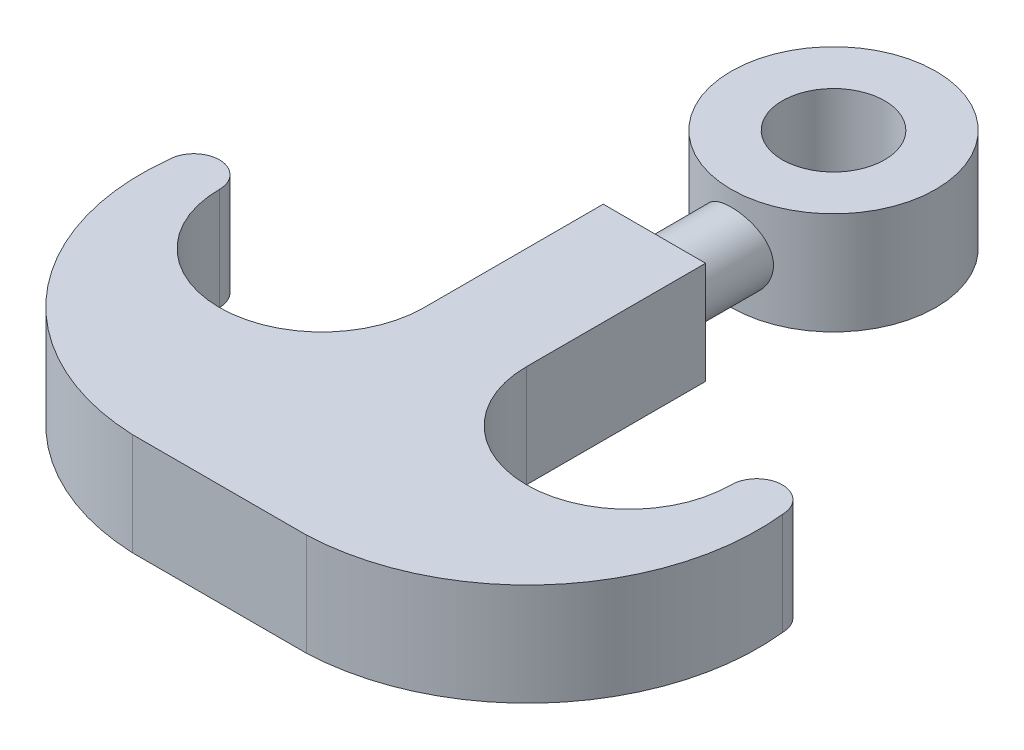
from build123d import *

# Parameters (mm, degrees)
BOSS_EXTRUDE1_DEPTH        = 10
BOSS_EXTRUDE1_DEPTH_BACK   = 10
SKETCH4_R                  = 20
SKETCH4_R_2                = 10
BOSS_EXTRUDE1_2_DEPTH      = 10
BOSS_EXTRUDE1_2_DEPTH_BACK = 10
SKETCH6_R                  = 7
BOSS_EXTRUDE2_DEPTH        = 20
FILLET1_R                  = 3


with BuildPart() as part:
    # Sketch4 → Boss-Extrude1 (new, two sides: drawn at the far end of the back side and taken through both)
    with BuildSketch(Plane(origin=(0, 0, 0), x_dir=(1, 0, 0), z_dir=(0, 1, 0)).offset(-BOSS_EXTRUDE1_DEPTH_BACK)):
        with Locations(Location((0, 0, 0), (0, 0, 270))):
            Circle(SKETCH4_R)
        with Locations(Location((0, 0, 0), (0, 0, 270))):
            Circle(SKETCH4_R_2, mode=Mode.SUBTRACT)
    extrude(amount=BOSS_EXTRUDE1_DEPTH + BOSS_EXTRUDE1_DEPTH_BACK)



with BuildPart() as body_2:
    # Sketch4 → Boss-Extrude1 2 (new, two sides: drawn at the far end of the back side and taken through both)
    with BuildSketch(Plane(origin=(0, 0, 0), x_dir=(1, 0, 0), z_dir=(0, 1, 0)).offset(-BOSS_EXTRUDE1_2_DEPTH_BACK)):
        with BuildLine():
            Line((-10, -35), (10, -35))
            Line((10, -35), (10, -70))
            ThreePointArc((10, -70), (30, -90), (50, -70))
            ThreePointArc((50, -70), (55, -65), (60, -70))
            ThreePointArc((60, -70), (49.38848107, -104.36409372), (17, -120))
            Line((17, -120), (-17, -120))
            ThreePointArc((-17, -120), (-49.38848107, -104.36409372), (-60, -70))
            ThreePointArc((-60, -70), (-55, -65), (-50, -70))
            ThreePointArc((-50, -70), (-30, -90), (-10, -70))
            Line((-10, -70), (-10, -35))
        make_face()
    extrude(amount=BOSS_EXTRUDE1_2_DEPTH + BOSS_EXTRUDE1_2_DEPTH_BACK)


with BuildPart() as part_1:
    add(part.part)

    add(body_2.part)  # Boss-Extrude2 merges body 2
    # Sketch6 → Boss-Extrude2 (add)
    with BuildSketch(Plane(origin=(0, 0, 35), x_dir=(-1, 0, 0), z_dir=(0, 0, -1))):
        with Locations(Location((0, 0, 0), (0, 0, 180))):
            Circle(SKETCH6_R)
    extrude(amount=BOSS_EXTRUDE2_DEPTH)

    # Fillet1
    fillet1_edges = [part_1.edges().sort_by_distance(p)[0] for p in [
        (-7, 0, 35),
    ]]
    fillet(fillet1_edges, radius=FILLET1_R - 0.0001)  # a hair under: the kernel refuses the full size


solid = part_1.part
